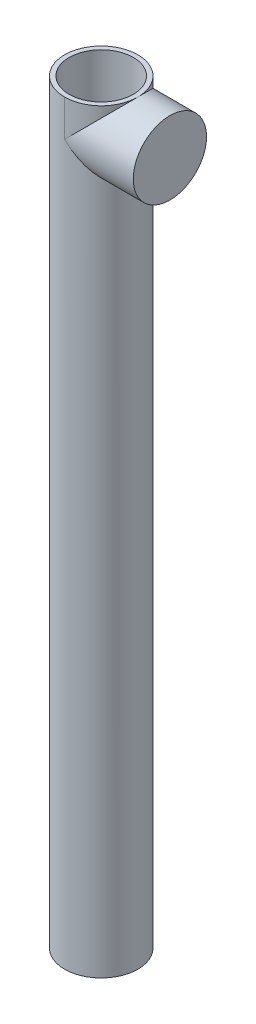
from build123d import *

# Parameters (mm, degrees)
SKETCH1_W           = 8
SKETCH1_H           = 165
SKETCH4_R           = 8
BOSS_EXTRUDE1_DEPTH = 15
SKETCH3_R           = 7
CUT_EXTRUDE1_DEPTH  = 166.873445735


with BuildPart() as part:
    # Sketch1 → Revolve1 (revolve)
    with BuildSketch(Plane.XY):
        with Locations((4, 0)):
            Rectangle(SKETCH1_W, SKETCH1_H)
    revolve(axis=Axis((0, 82.5, 0), (0, -1, 0)))

    # Sketch4 → Boss-Extrude1 (add)
    with BuildSketch(Plane(origin=(0, 0, 0), x_dir=(0, 0, -1), z_dir=(1, 0, 0))):
        with Locations((0, 74.5)):
            Circle(SKETCH4_R)
    extrude(amount=BOSS_EXTRUDE1_DEPTH)

    # Sketch3 → Cut-Extrude1 (cut, through all)
    with BuildSketch(Plane(origin=(0, 82.5, 0), x_dir=(1, 0, 0), z_dir=(0, 1, 0))):
        Circle(SKETCH3_R)
    extrude(amount=-CUT_EXTRUDE1_DEPTH, mode=Mode.SUBTRACT)


solid = part.part
